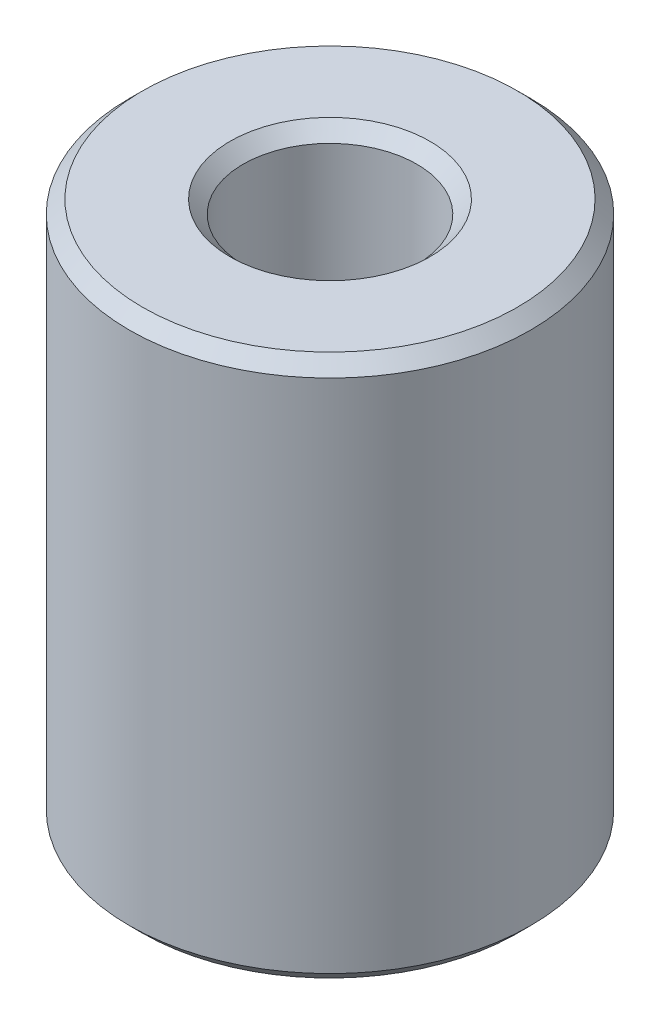
from build123d import *

# Parameters (mm, degrees)
SKETCH1_R           = 12.5
BOSS_EXTRUDE1_DEPTH = 33.773740315
SKETCH2_R           = 5.411276902
CUT_EXTRUDE1_DEPTH  = 39.120408377
CHAMFER1_SIZE       = 0.821694141


with BuildPart() as part:
    # Sketch1 → Boss-Extrude1 (new body)
    with BuildSketch(Plane(origin=(0, 0, 0), x_dir=(1, 0, 0), z_dir=(0, 1, 0))):
        Circle(SKETCH1_R)
    extrude(amount=BOSS_EXTRUDE1_DEPTH)

    # Sketch2 → Cut-Extrude1 (cut, through all)
    with BuildSketch(Plane(origin=(0, 0, 0), x_dir=(1, 0, 0), z_dir=(0, 1, 0))):
        Circle(SKETCH2_R)
    extrude(amount=CUT_EXTRUDE1_DEPTH, mode=Mode.SUBTRACT)

    # Chamfer1
    chamfer1_edges = [part.edges().sort_by_distance(p)[0] for p in [
        (-5.411276902, 33.773740315, 0),
        (-5.411276902, 0, 0),
        (-12.5, 0, 0),
        (-12.5, 33.773740315, 0),
    ]]
    chamfer(chamfer1_edges, length=CHAMFER1_SIZE)


solid = part.part
